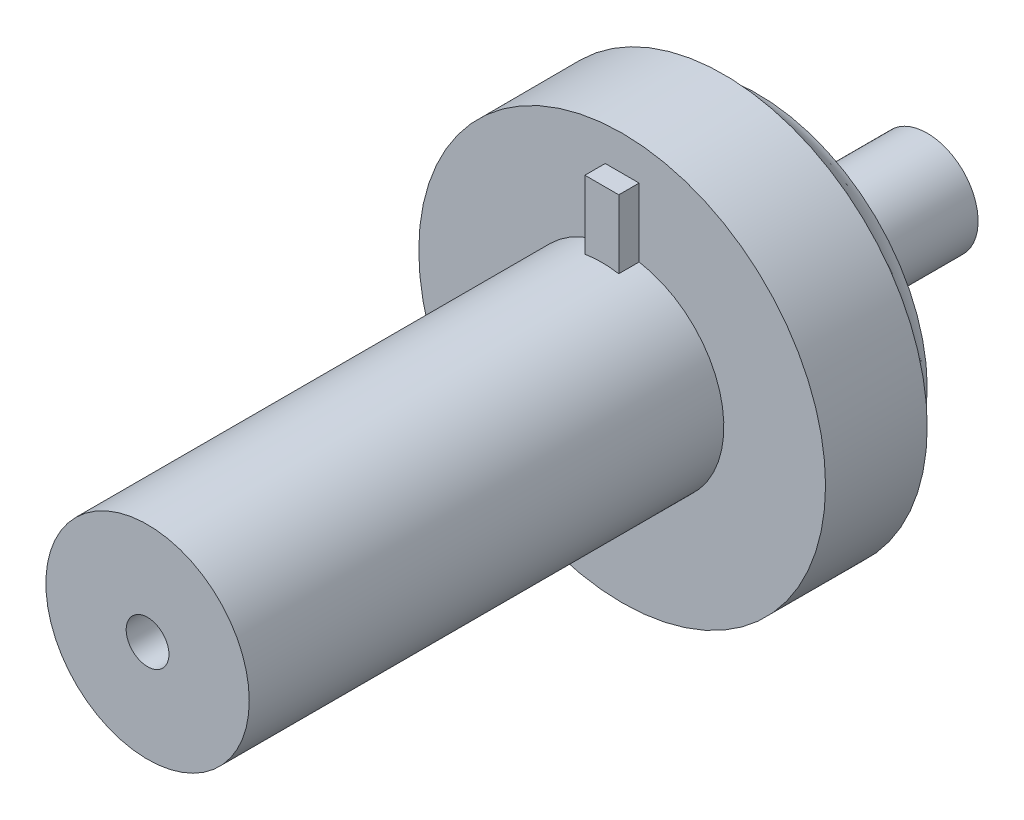
from build123d import *

# Parameters (mm, degrees)
SKETCH1_R           = 15
BOSS_EXTRUDE1_DEPTH = 80
SKETCH1_2_R         = 15
SKETCH2_R           = 25
SKETCH3_R           = 7.5
BOSS_EXTRUDE2_DEPTH = 25
SKETCH4_W           = 5
SKETCH4_H           = 25
BOSS_EXTRUDE3_DEPTH = 3
SKETCH5_R           = 3.15
CUT_EXTRUDE1_DEPTH  = 6
SKETCH6_R           = 30
BOSS_EXTRUDE4_DEPTH = 15


with BuildPart() as part:
    # Sketch1 → Boss-Extrude1 (new body)
    with BuildSketch(Plane.XY):
        Circle(SKETCH1_R)
    extrude(amount=BOSS_EXTRUDE1_DEPTH)

    # Sketch1<2> → Loft1 section 0
    with BuildSketch(Plane.XY):
        Circle(SKETCH1_2_R)
    # Sketch2 → Loft1 section 1
    with BuildSketch(Plane(origin=(0, 0, -10), x_dir=(-1, 0, 0), z_dir=(0, 0, -1))):
        Circle(SKETCH2_R)
    loft()

    # Sketch3 → Boss-Extrude2 (add)
    with BuildSketch(Plane(origin=(0, 0, -10), x_dir=(-1, 0, 0), z_dir=(0, 0, -1))):
        Circle(SKETCH3_R)
    extrude(amount=BOSS_EXTRUDE2_DEPTH)

    # Sketch4 → Boss-Extrude3 (add)
    with BuildSketch(Plane.XY.offset(10)):
        with Locations((0.003158662, 12.374368268)):
            Rectangle(SKETCH4_W, SKETCH4_H)
    extrude(amount=BOSS_EXTRUDE3_DEPTH)

    # Sketch5 → Cut-Extrude1 (cut)
    with BuildSketch(Plane.XY.offset(80)):
        Circle(SKETCH5_R)
    extrude(amount=-CUT_EXTRUDE1_DEPTH, mode=Mode.SUBTRACT)

    # Sketch6 → Boss-Extrude4 (add)
    with BuildSketch(Plane.XY.offset(10)):
        Circle(SKETCH6_R)
    extrude(amount=-BOSS_EXTRUDE4_DEPTH)

    # Loft3: read off the stored shape, not the designer's step
    # Loft3: loft between two sections, ruled curve by curve
    loft3_from = [
        Edge.make_bspline([(-27.865450574, 11.113805123, -5), (-5.637840328, 66.844706271, -5), (50.09306082, 44.617096025, -5), (27.865450574, -11.113805123, -5), (5.637840328, -66.844706271, -5), (-50.09306082, -44.617096025, -5), (-27.865450574, 11.113805123, -5)], [0, 0, 0, 0, 0.5, 0.5, 0.5, 1, 1, 1, 1], 3, [1, 0.333333333, 0.333333333, 1, 0.333333333, 0.333333333, 1]),
    ]
    loft3_to = [
        Edge.make_bspline([(-16.473801558, 18.804623427, -10), (21.135445295, 51.752226543, -10), (54.083048412, 14.14297969, -10), (16.473801558, -18.804623427, -10), (-21.135445295, -51.752226543, -10), (-54.083048412, -14.14297969, -10), (-16.473801558, 18.804623427, -10)], [0, 0, 0, 0, 0.5, 0.5, 0.5, 1, 1, 1, 1], 3, [1, 0.333333333, 0.333333333, 1, 0.333333333, 0.333333333, 1]),
    ]
    loft3 = Solid(Shell([*[Face.make_surface_from_curves(loft3_from[k], loft3_to[k]) for k in range(1)], Face(Wire(loft3_from)), Face(Wire(loft3_to))]))
    add(loft3)


solid = part.part
